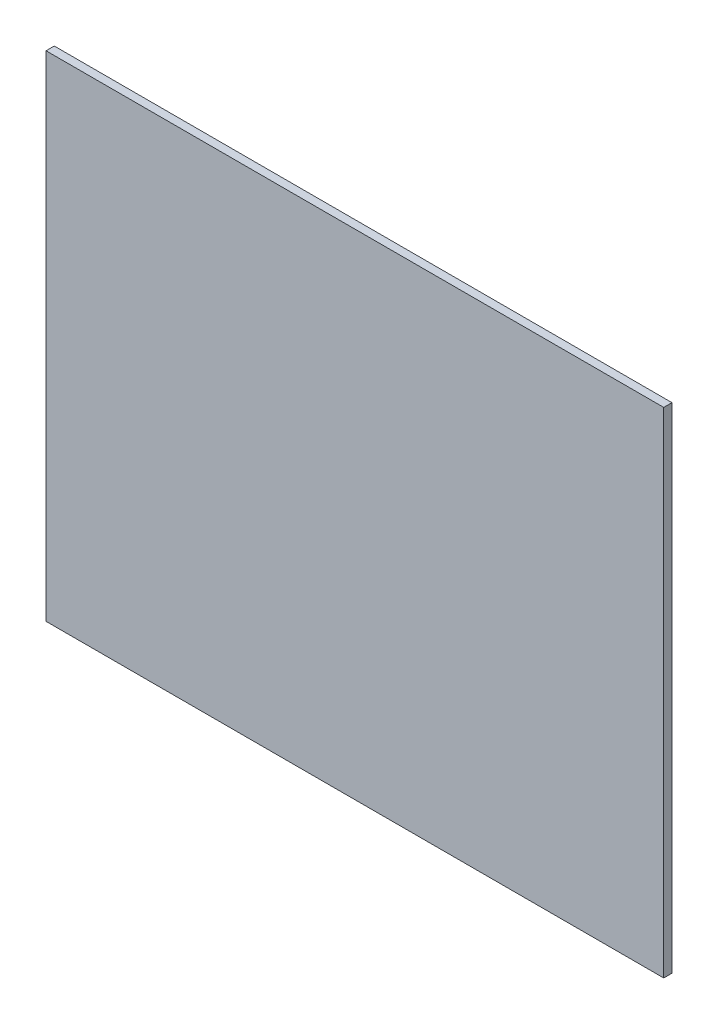
from build123d import *

# Parameters (mm, degrees)
SKETCH1_W           = 381
SKETCH1_H           = 304.8
BOSS_EXTRUDE1_DEPTH = 5.08


with BuildPart() as part:
    # Sketch1 → Boss-Extrude1 (new body)
    with BuildSketch(Plane.XY):
        with Locations((190.5, 152.4)):
            Rectangle(SKETCH1_W, SKETCH1_H)
    extrude(amount=BOSS_EXTRUDE1_DEPTH)


solid = part.part
